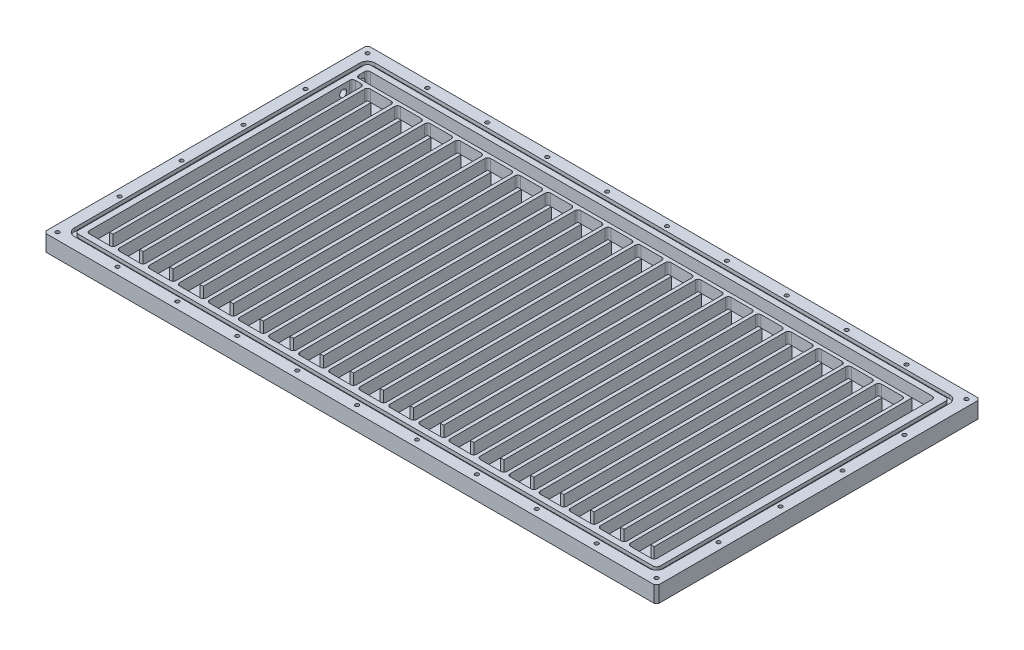
from build123d import *

# Parameters (mm, degrees)
SKETCH1_W             = 265
SKETCH1_H             = 140
BOSS_EXTRUDE1_DEPTH   = 14
CUT_EXTRUDE1_DEPTH    = 3
FILLET1_R             = 3
FILLET2_R             = 6.5
M4X0_7_TAPPED_HOLE1_D = 3.3
MIRROR4_COPY_1_D      = 3.3
MIRROR4_COPY_2_D      = 3.3
SKETCH3_W             = 10
SKETCH3_H             = 230
CUT_EXTRUDE2_DEPTH    = 10
LPATTERN1_COUNT       = 38
LPATTERN1_PITCH       = 13
SKETCH4_W             = 3
SKETCH4_H             = 10
CUT_EXTRUDE3_DEPTH    = 10
LPATTERN2_COUNT       = 19
LPATTERN2_PITCH       = 26
SKETCH5_W             = 3
SKETCH5_H             = 10
CUT_EXTRUDE4_DEPTH    = 10
LPATTERN3_COUNT       = 18
LPATTERN3_PITCH       = 26
CUT_EXTRUDE5_DEPTH    = 10
FILLET3_R             = 2.5
FILLET4_R             = 2.5
CHAMFER1_SIZE         = 2
FILLET5_R             = 2.5
LPATTERN10_COUNT      = 2
LPATTERN10_PITCH      = 16


with BuildPart() as part:
    # Sketch1 → Boss-Extrude1 (new body)
    with BuildSketch(Plane(origin=(0, 0, 0), x_dir=(1, 0, 0), z_dir=(0, 1, 0))):
        with Locations((132.5, 70)):
            Rectangle(SKETCH1_W, SKETCH1_H)
    extrude(amount=BOSS_EXTRUDE1_DEPTH)

    # Sketch2 → Cut-Extrude1 (cut)
    with BuildSketch(Plane(origin=(0, 14, 0), x_dir=(1, 0, 0), z_dir=(0, 1, 0))):
        Polygon((10, 140), (13.5, 140), (13.5, 13.5), (265, 13.5), (265, 10), (14.894895508, 10), (10, 10), align=None)
    extrude(amount=-CUT_EXTRUDE1_DEPTH, mode=Mode.SUBTRACT)

    # Fillet1
    fillet1_edges = [part.edges().sort_by_distance(p)[0] for p in [
        (13.5, 12.5, -13.5),
    ]]
    fillet(fillet1_edges, radius=FILLET1_R)

    # Fillet2
    fillet2_edges = [part.edges().sort_by_distance(p)[0] for p in [
        (10, 12.5, -10),
    ]]
    fillet(fillet2_edges, radius=FILLET2_R)

    # Mirror1: part across plane


with BuildPart() as part_1:
    add(part.part)
    add(part.part.mirror(Plane(origin=(265, 14, 0), x_dir=(0, 0, 1), z_dir=(-1, 0, 0))))

    # Mirror2: part across plane


with BuildPart() as part_2:
    add(part_1.part)
    add(part_1.part.mirror(Plane(origin=(0, 14, -140), x_dir=(1, 0, 0), z_dir=(0, 0, 1))))

    # M4x0.7 Tapped Hole1 (through all)
    with Locations(Plane(origin=(6, 0, -113.2), x_dir=(0, 0, -1), z_dir=(0, -1, 0))):
        with Locations((0, 0), (-53.6, 0), (-107.2, 0), (-107.2, 51.8), (-107.2, 103.6), (-107.2, 155.4), (-107.2, 207.2), (-107.2, 259)):
            m4x0_7_tapped_hole1 = Hole(M4X0_7_TAPPED_HOLE1_D / 2)

    # Mirror3: M4x0.7 Tapped Hole1 across plane
    add(m4x0_7_tapped_hole1.mirror(Plane.XY.offset(-140)), mode=Mode.SUBTRACT)

    # Mirror4 copy 1 (through all)
    with Locations(Plane(origin=(524, 0, -166.8), x_dir=(0, 0, 1), z_dir=(0, -1, 0))):
        with Locations((0, 0), (-53.6, 0), (-107.2, 0), (-107.2, 51.8), (-107.2, 103.6), (-107.2, 155.4), (-107.2, 207.2), (-107.2, 259)):
            Hole(MIRROR4_COPY_1_D / 2)

    # Mirror4 copy 2 (through all)
    with Locations(Plane(origin=(524, 0, -113.2), x_dir=(0, 0, -1), z_dir=(0, -1, 0))):
        with Locations((0, 0), (-53.6, 0), (-107.2, 0), (-107.2, -51.8), (-107.2, -103.6), (-107.2, -155.4), (-107.2, -207.2), (-107.2, -259)):
            Hole(MIRROR4_COPY_2_D / 2)

    # Sketch3 → Cut-Extrude2 (cut)
    with BuildSketch(Plane(origin=(0, 14, 0), x_dir=(1, 0, 0), z_dir=(0, 1, 0))):
        with Locations((23.5, 133.5)):
            Rectangle(SKETCH3_W, SKETCH3_H)
    cut_extrude2 = extrude(amount=-CUT_EXTRUDE2_DEPTH, mode=Mode.SUBTRACT)

    # LPattern1: Cut-Extrude2 ×38
    with Locations(*[(i * LPATTERN1_PITCH, 0, 0) for i in range(1, LPATTERN1_COUNT)]):
        add(cut_extrude2, mode=Mode.SUBTRACT)

    # Sketch4 → Cut-Extrude3 (cut)
    with BuildSketch(Plane(origin=(0, 14, 0), x_dir=(1, 0, 0), z_dir=(0, 1, 0))):
        with Locations((30, 23.5)):
            Rectangle(SKETCH4_W, SKETCH4_H)
    cut_extrude3 = extrude(amount=-CUT_EXTRUDE3_DEPTH, mode=Mode.SUBTRACT)

    # LPattern2: Cut-Extrude3 ×19
    with Locations(*[(i * LPATTERN2_PITCH, 0, 0) for i in range(1, LPATTERN2_COUNT)]):
        add(cut_extrude3, mode=Mode.SUBTRACT)

    # Sketch5 → Cut-Extrude4 (cut)
    with BuildSketch(Plane(origin=(0, 14, 0), x_dir=(1, 0, 0), z_dir=(0, 1, 0))):
        with Locations((43, 243.5)):
            Rectangle(SKETCH5_W, SKETCH5_H)
    cut_extrude4 = extrude(amount=-CUT_EXTRUDE4_DEPTH, mode=Mode.SUBTRACT)

    # LPattern3: Cut-Extrude4 ×18
    with Locations(*[(i * LPATTERN3_PITCH, 0, 0) for i in range(1, LPATTERN3_COUNT)]):
        add(cut_extrude4, mode=Mode.SUBTRACT)

    # Sketch6 → Cut-Extrude5 (cut)
    with BuildSketch(Plane(origin=(0, 14, 0), x_dir=(1, 0, 0), z_dir=(0, 1, 0))):
        Polygon((18.5, 261.5), (509.5, 261.5), (509.5, 248.5), (499.5, 248.5), (499.5, 251.5), (18.5, 251.5), align=None)
    extrude(amount=-CUT_EXTRUDE5_DEPTH, mode=Mode.SUBTRACT)

    # Fillet3
    fillet3_edges = [part_2.edges().sort_by_distance(p)[0] for p in [
        (18.5, 9, -18.5),
        (41.5, 9, -18.5),
        (44.5, 9, -18.5),
        (67.5, 9, -18.5),
        (70.5, 9, -18.5),
        (93.5, 9, -18.5),
        (96.5, 9, -18.5),
        (119.5, 9, -18.5),
        (122.5, 9, -18.5),
        (145.5, 9, -18.5),
        (148.5, 9, -18.5),
        (171.5, 9, -18.5),
        (174.5, 9, -18.5),
        (197.5, 9, -18.5),
        (200.5, 9, -18.5),
        (223.5, 9, -18.5),
        (226.5, 9, -18.5),
        (249.5, 9, -18.5),
        (252.5, 9, -18.5),
        (275.5, 9, -18.5),
        (278.5, 9, -18.5),
        (301.5, 9, -18.5),
        (304.5, 9, -18.5),
        (327.5, 9, -18.5),
        (330.5, 9, -18.5),
        (353.5, 9, -18.5),
        (356.5, 9, -18.5),
        (379.5, 9, -18.5),
        (382.5, 9, -18.5),
        (405.5, 9, -18.5),
        (408.5, 9, -18.5),
        (431.5, 9, -18.5),
        (434.5, 9, -18.5),
        (457.5, 9, -18.5),
        (460.5, 9, -18.5),
        (483.5, 9, -18.5),
        (486.5, 9, -18.5),
        (509.5, 9, -18.5),
        (473.5, 9, -248.5),
        (447.5, 9, -248.5),
        (421.5, 9, -248.5),
        (395.5, 9, -248.5),
        (369.5, 9, -248.5),
        (343.5, 9, -248.5),
        (317.5, 9, -248.5),
        (291.5, 9, -248.5),
        (265.5, 9, -248.5),
        (239.5, 9, -248.5),
        (213.5, 9, -248.5),
        (187.5, 9, -248.5),
        (161.5, 9, -248.5),
        (135.5, 9, -248.5),
        (109.5, 9, -248.5),
        (57.5, 9, -248.5),
        (31.5, 9, -248.5),
        (496.5, 9, -248.5),
        (470.5, 9, -248.5),
        (444.5, 9, -248.5),
        (418.5, 9, -248.5),
        (392.5, 9, -248.5),
        (366.5, 9, -248.5),
        (340.5, 9, -248.5),
        (314.5, 9, -248.5),
        (288.5, 9, -248.5),
        (262.5, 9, -248.5),
        (236.5, 9, -248.5),
        (210.5, 9, -248.5),
        (83.5, 9, -248.5),
        (106.5, 9, -248.5),
        (184.5, 9, -248.5),
        (158.5, 9, -248.5),
        (132.5, 9, -248.5),
        (80.5, 9, -248.5),
        (54.5, 9, -248.5),
        (28.5, 9, -248.5),
        (509.5, 9, -261.5),
    ]]
    fillet(fillet3_edges, radius=FILLET3_R)

    # Fillet4
    fillet4_edges = [part_2.edges().sort_by_distance(p)[0] for p in [
        (18.5, 9, -248.5),
    ]]
    fillet(fillet4_edges, radius=FILLET4_R)

    # Chamfer1
    chamfer1_edges = [part_2.edges().sort_by_distance(p)[0] for p in [
        (530, 7, -280),
        (530, 7, 0),
        (0, 7, 0),
        (0, 7, -280),
    ]]
    chamfer(chamfer1_edges, length=CHAMFER1_SIZE)

    # Sketch8 → G1/8 Tapped Hole1 (revolve, cut)
    with BuildSketch(Plane(origin=(0, 7, -256.5), x_dir=(0, 0, 1), z_dir=(0, 1, 0))):
        Polygon((0, 0), (0, 11.363786724), (4.4, 8.72), (4.4, 0), align=None)
    g1_8_tapped_hole1 = revolve(axis=Axis((-6.35, 7, -256.5), (1, 0, 0)), mode=Mode.SUBTRACT)

    # Fillet5
    fillet5_edges = [part_2.edges().sort_by_distance(p)[0] for p in [
        (18.5, 9, -251.5),
        (18.5, 9, -261.5),
    ]]
    fillet(fillet5_edges, radius=FILLET5_R)

    # Sketch10 → Ø6.0 (6) Diameter Hole1 (revolve, cut)
    with BuildSketch(Plane(origin=(0, 7, -256.5), x_dir=(0, 0, 1), z_dir=(0, 1, 0))):
        Polygon((0, 0), (0, 23.802581857), (3, 22), (3, 0), align=None)
    f_6_0_6_diameter_hole1 = revolve(axis=Axis((-6.35, 7, -256.5), (1, 0, 0)), mode=Mode.SUBTRACT)

    # LPattern10: G1/8 Tapped Hole1, Ø6.0 (6) Diameter Hole1 ×2
    with Locations(*[(0, 0, i * LPATTERN10_PITCH) for i in range(1, LPATTERN10_COUNT)]):
        add(g1_8_tapped_hole1, mode=Mode.SUBTRACT)
        add(f_6_0_6_diameter_hole1, mode=Mode.SUBTRACT)


solid = part_2.part
